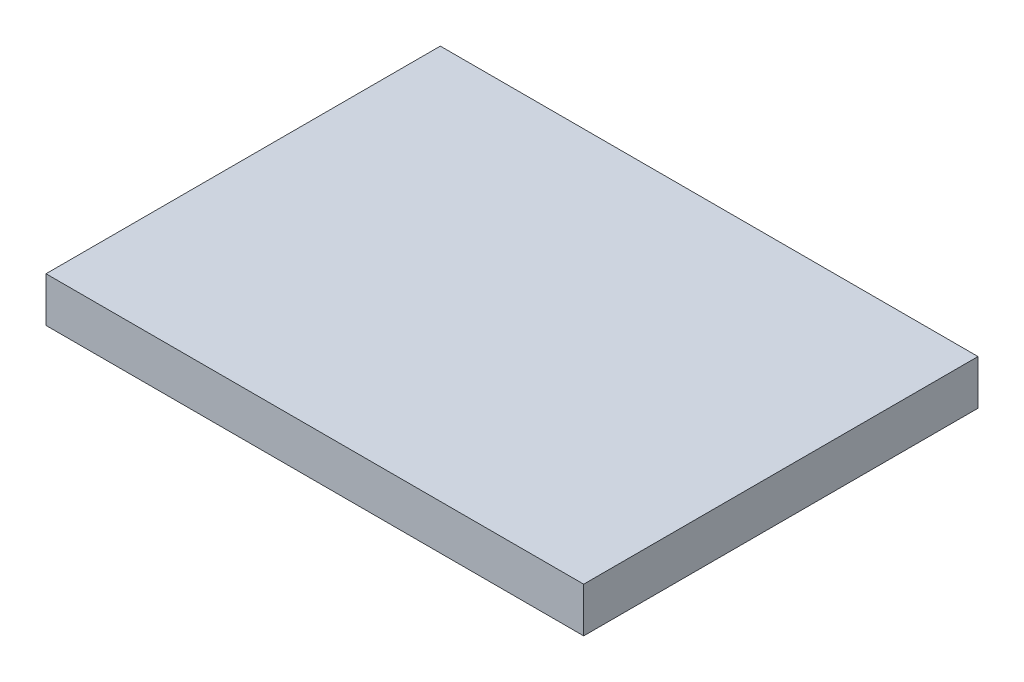
from build123d import *

# Parameters (mm, degrees)
EXTRUDE2_START     = -11.1125
EXTRUDE2_OUTLINE_R = 7.9375
EXTRUDE2_DEPTH     = 22.225
SKETCH2_W          = 762
SKETCH2_H          = 63.5
EXTRUDE3_DEPTH     = 279.4


# Read off the part's stored shape, not the designer's step: Extrude2
with BuildPart() as part:
    # Extrude2 outline → Extrude2 (new body)
    with BuildSketch(Plane.XY.offset(EXTRUDE2_START)):
        with BuildLine():
            ThreePointArc((55.379666285, 831.639308698), (87.129666285, 799.889308698), (118.879666285, 831.639308698))
            Line((118.879666285, 831.639308698), (118.879666285, 867.199308698))
            Line((118.879666285, 867.199308698), (55.379666285, 867.199308698))
            Line((55.379666285, 867.199308698), (55.379666285, 831.639308698))
        make_face()
        with Locations((87.129666285, 831.639308698)):
            Circle(EXTRUDE2_OUTLINE_R, mode=Mode.SUBTRACT)
    extrude(amount=EXTRUDE2_DEPTH)

    # Sketch2 → Extrude3 (add, symmetric)
    with BuildSketch(Plane.XY):
        with Locations((87.129666285, 898.949308698)):
            Rectangle(SKETCH2_W, SKETCH2_H)
    extrude(amount=EXTRUDE3_DEPTH, both=True)


solid = part.part
